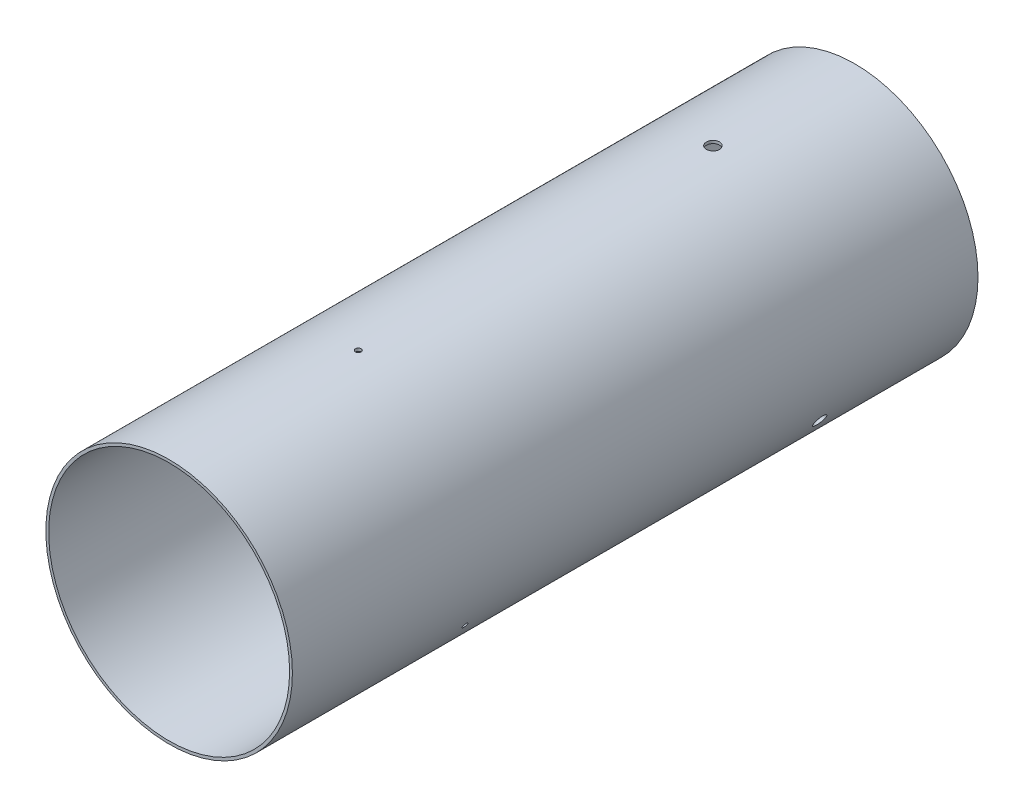
from build123d import *

# Parameters (mm, degrees)
SKETCH1_R                = 49.6697
SKETCH1_R_2              = 48.5394
BOSS_EXTRUDE1_DEPTH      = 276.225
SKETCH2_R                = 2.6289
SKETCH2_R_2              = 1.143
F_8_32_T_NUT_HOLES_DEPTH = 5.08
CIRPATTERN1_COUNT        = 3


with BuildPart() as part:
    # Sketch1 → Boss-Extrude1 (new body)
    with BuildSketch(Plane.XY):
        Circle(SKETCH1_R)
        Circle(SKETCH1_R_2, mode=Mode.SUBTRACT)
    extrude(amount=BOSS_EXTRUDE1_DEPTH)

    # Sketch2 → 8-32 T-Nut Holes (cut)
    with BuildSketch(Plane(origin=(0, 49.6697, 0), x_dir=(1, 0, 0), z_dir=(0, 1, 0))):
        with Locations((0, -57.15)):
            Circle(SKETCH2_R)
        with Locations((0, -200.025)):
            Circle(SKETCH2_R_2)
    f_8_32_t_nut_holes = extrude(amount=-F_8_32_T_NUT_HOLES_DEPTH, mode=Mode.SUBTRACT)

    # CirPattern1: 8-32 T-Nut Holes ×3 about axis
    cirpattern1_axis = Axis((0, 0, 276.225), (0, 0, -1))
    for i in range(1, CIRPATTERN1_COUNT):
        add(f_8_32_t_nut_holes.rotate(cirpattern1_axis, i * 360 / CIRPATTERN1_COUNT), mode=Mode.SUBTRACT)


solid = part.part
